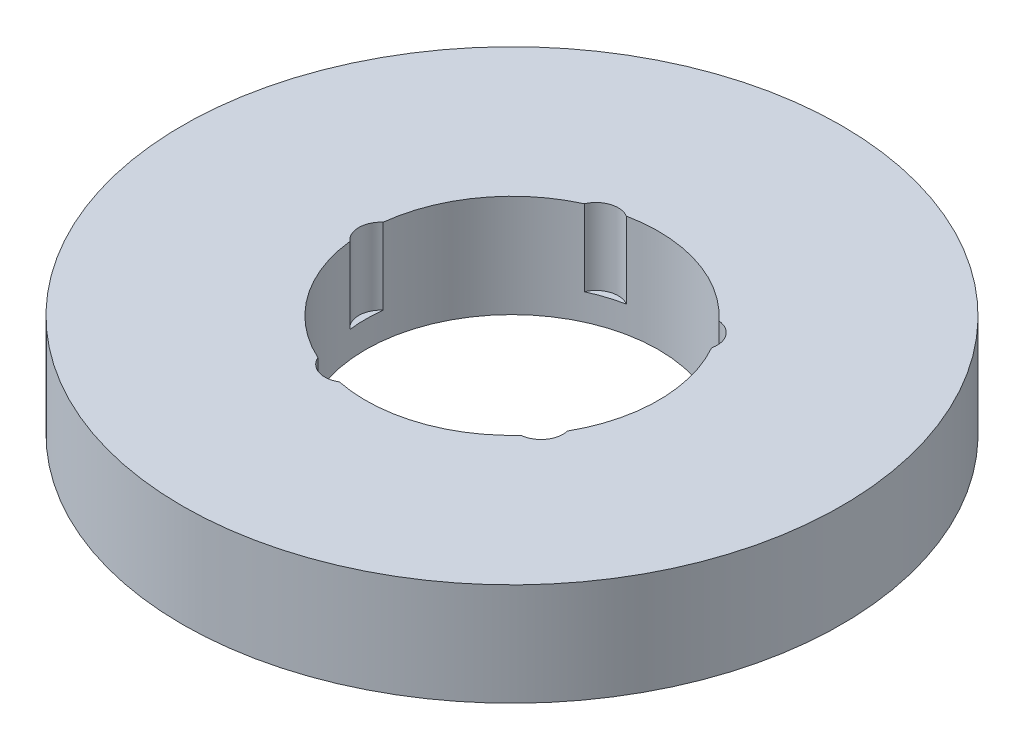
from build123d import *

# Parameters (mm, degrees)
SKETCH1_R           = 45
BOSS_EXTRUDE1_DEPTH = 14
SKETCH2_R           = 20
CUT_EXTRUDE1_DEPTH  = 66.161338231
SKETCH3_R           = 3.022800285
CUT_EXTRUDE2_DEPTH  = 10.405677142
CIRPATTERN1_COUNT   = 5


with BuildPart() as part:
    # Sketch1 → Boss-Extrude1 (new body)
    with BuildSketch(Plane(origin=(0, 0, 0), x_dir=(1, 0, 0), z_dir=(0, 1, 0))):
        Circle(SKETCH1_R)
    extrude(amount=BOSS_EXTRUDE1_DEPTH)

    # Sketch2 → Cut-Extrude1 (cut, through all)
    with BuildSketch(Plane(origin=(0, 0, 0), x_dir=(1, 0, 0), z_dir=(0, 1, 0))):
        Circle(SKETCH2_R)
    extrude(amount=CUT_EXTRUDE1_DEPTH, mode=Mode.SUBTRACT)

    # Sketch3 → Cut-Extrude2 (cut)
    with BuildSketch(Plane(origin=(0, 14, 0), x_dir=(1, 0, 0), z_dir=(0, 1, 0))):
        with Locations((-17.883399407, 0)):
            Circle(SKETCH3_R)
    cut_extrude2 = extrude(amount=-CUT_EXTRUDE2_DEPTH, mode=Mode.SUBTRACT)

    # CirPattern1: Cut-Extrude2 ×5 about axis
    cirpattern1_axis = Axis((0, 0, 0), (0, 1, 0))
    for i in range(1, CIRPATTERN1_COUNT):
        add(cut_extrude2.rotate(cirpattern1_axis, i * 360 / CIRPATTERN1_COUNT), mode=Mode.SUBTRACT)


solid = part.part
